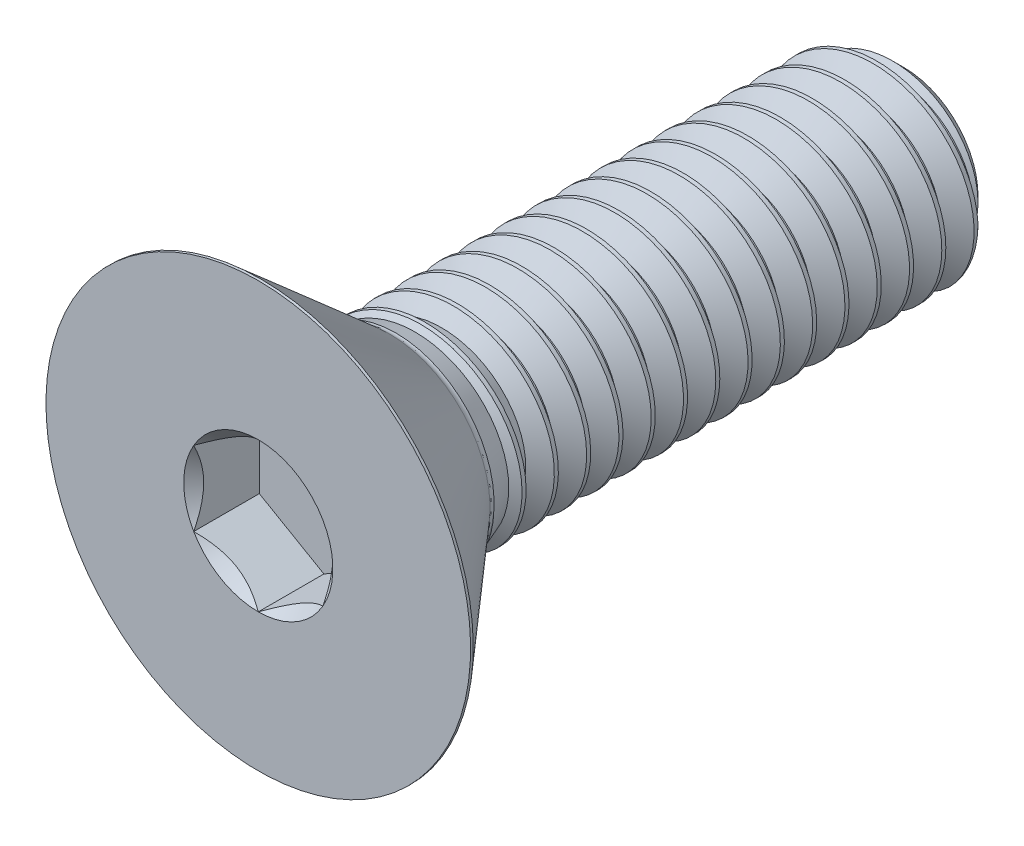
from build123d import *

# Parameters (mm, degrees)
SKETCH10_R         = 1.833087105
CUT_EXTRUDE2_DEPTH = 1.6129
CUT_EXTRUDE2_DRAFT = -45
CUT_EXTRUDE1_DEPTH = 1.6129
CUT_SWEEP1_PITCH   = 0.79375
CUT_SWEEP1_TO      = 12.492366


with BuildPart() as part:
    # Sketch11 → Revolve1 (revolve)
    with BuildSketch(Plane(origin=(0, 0, 0), x_dir=(0, 0, -1), z_dir=(1, 0, 0))):
        with BuildLine():
            Line((-7.872984, 5.2197), (-4.7117, 2.471637744))
            ThreePointArc((-4.7117, 2.471637744), (-4.63858483, 2.428138789), (-4.554866229, 2.413))
            Line((-4.554866229, 2.413), (7.3421875, 2.413))
            Line((7.3421875, 2.413), (7.9375, 1.8176875))
            Line((7.9375, 1.8176875), (7.9375, 0))
            Line((7.9375, 0), (-7.9375, 0))
            Line((-7.9375, 0), (-7.9375, 5.2197))
            Line((-7.9375, 5.2197), (-7.872984, 5.2197))
        make_face()
    revolve(axis=Axis((0, 0, -7.9375), (0, 0, 1)))


with BuildPart() as cut_extrude2_tool:
    # Sketch10 → Cut-Extrude2 (with draft: the straight prism first)
    with BuildSketch(Plane.XY.offset(7.9375)):
        Circle(SKETCH10_R)
    extrude(amount=-CUT_EXTRUDE2_DEPTH)
    # Cut-Extrude2: the draft: its side faces are tilted about the plane it starts from
    cut_extrude2_sides = [cut_extrude2_tool.faces().sort_by_distance(p)[0] for p in [
        (-1.833087105, 0, 7.13105),
    ]]
    draft(cut_extrude2_sides, Plane.XY.offset(7.9375), CUT_EXTRUDE2_DRAFT)


with BuildPart() as part_1:
    add(part.part)

    # Cut-Extrude2: cut by cut_extrude2_tool
    add(cut_extrude2_tool.part, mode=Mode.SUBTRACT)

    # Sketch9 → Cut-Extrude1 (cut)
    with BuildSketch(Plane.XY.offset(7.9375)):
        Polygon((1.5875, -0.916543552), (1.5875, 0.916543552), (0, 1.833087105), (-1.5875, 0.916543552), (-1.5875, -0.916543552), (0, -1.833087105), align=None)
    extrude(amount=-CUT_EXTRUDE1_DEPTH, mode=Mode.SUBTRACT)


with BuildPart() as body_2:
    # Split1: the piece on the far side of the plane
    add(part_1.part)
    split(bisect_by=Plane.XY.offset(4.554866229), keep=Keep.BOTTOM)

    # Cut-Sweep1: arcs per turn and ends read off the stored shape
    # Cut-Sweep1: the profile of Sketch4 screwed along a right-hand helix through 20 turns, 8 arcs to a turn; built about Z, then put on its axis
    cut_sweep1_z = Axis((0, 0, 0), (0, 0, 1))
    cut_sweep1_corners = [(2.455962979, 0, 0.024804688), (2.455962979, 0, -0.719335938), (1.897444252, 0, -0.396875), (1.897444252, 0, -0.29765625)]
    with BuildLine(mode=Mode.PRIVATE) as cut_sweep1_profile:
        Line(cut_sweep1_corners[0], cut_sweep1_corners[1])
        Line(cut_sweep1_corners[1], cut_sweep1_corners[2])
        Line(cut_sweep1_corners[2], cut_sweep1_corners[3])
        Line(cut_sweep1_corners[3], cut_sweep1_corners[0])
    cut_sweep1_cap = Face(cut_sweep1_profile.wire())
    cut_sweep1_turn_angles = [0, 22.5, 45, 67.5, 90, 112.5, 135, 157.5, 180, 202.5, 225, 247.5, 270, 292.5, 315, 337.5, 360]
    cut_sweep1_turn_weights = [1, 0.9238795325112867, 1, 0.9238795325112867, 1, 0.9238795325112867, 1, 0.9238795325112867, 1, 0.9238795325112867, 1, 0.9238795325112867, 1, 0.9238795325112867, 1, 0.9238795325112867, 1]
    cut_sweep1_turn_rails = [Edge.make_bspline([Vector(p[0], p[1], 0).rotate(cut_sweep1_z, cut_sweep1_turn_angles[k]) / cut_sweep1_turn_weights[k] + Vector(0, 0, p[2] + CUT_SWEEP1_PITCH * cut_sweep1_turn_angles[k] / 360) for k in range(17)], [0, 0, 0, 1, 1, 2, 2, 3, 3, 4, 4, 5, 5, 6, 6, 7, 7, 8, 8, 8], 2, cut_sweep1_turn_weights) for p in cut_sweep1_corners]
    cut_sweep1_turn_sides = [Face.make_surface_from_curves(cut_sweep1_turn_rails[p[0]], cut_sweep1_turn_rails[p[1]]) for p in [(0, 1), (1, 2), (2, 3), (3, 0)]]
    cut_sweep1 = Plane(origin=(0, 0, -7.9375), x_dir=(0, 1, 0), z_dir=(0, 0, 1)) * split(Solid(Shell([*[p.moved(Location((0, 0, CUT_SWEEP1_PITCH * i))) for i in range(20) for p in cut_sweep1_turn_sides], cut_sweep1_cap, cut_sweep1_cap.rotate(cut_sweep1_z, 7200).moved(Location((0, 0, CUT_SWEEP1_PITCH * 7200 / 360)))])), bisect_by=Plane.XY.offset(CUT_SWEEP1_TO), keep=Keep.BOTTOM, mode=Mode.PRIVATE)
    add(cut_sweep1, mode=Mode.SUBTRACT)


with BuildPart() as part_2:
    add(part_1.part)

    # Split1
    split(bisect_by=Plane.XY.offset(4.554866229), keep=Keep.TOP)

    add(body_2.part)  # Boss-Extrude2 merges body 2
    # Boss-Extrude2 cone 1 section (through the dimple's axis) → Boss-Extrude2 (revolve)
    with BuildSketch(Plane(origin=(0, 0, 4.554866229), x_dir=(0, -1, 0), z_dir=(1, 0, 0))):
        Polygon((0, 0), (2.413, 0), (0, 6.629663013), align=None)
    revolve(axis=Axis((0, 0, 4.554866229), (0, 0, -1)))


solid = part_2.part
